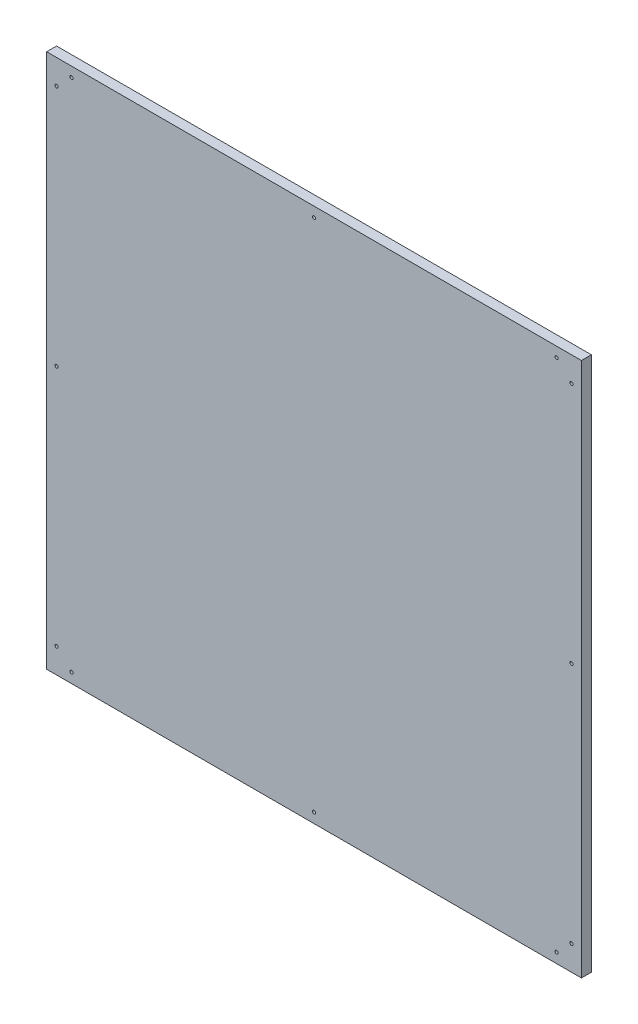
from build123d import *

# Parameters (mm, degrees)
SKETCH1_W              = 683.26
SKETCH1_H              = 683.26
BOSS_EXTRUDE1_DEPTH    = 12.7
F_10_32_TAPPED_HOLE1_D = 4.0386


with BuildPart() as part:
    # Sketch1 → Boss-Extrude1 (new body)
    with BuildSketch(Plane.XY):
        with Locations((341.63, 341.63)):
            Rectangle(SKETCH1_W, SKETCH1_H)
    extrude(amount=BOSS_EXTRUDE1_DEPTH)

    # #10-32 Tapped Hole1 (through all)
    with Locations(Plane.XY.offset(12.7)):
        with Locations((31.75, 670.56), (12.7, 651.51), (670.56, 651.51), (651.51, 670.56), (670.56, 31.75), (651.51, 12.7), (31.75, 12.7), (12.7, 31.75), (341.63, 670.56), (12.7, 341.63), (670.56, 341.63), (341.63, 12.7)):
            Hole(F_10_32_TAPPED_HOLE1_D / 2)


solid = part.part
